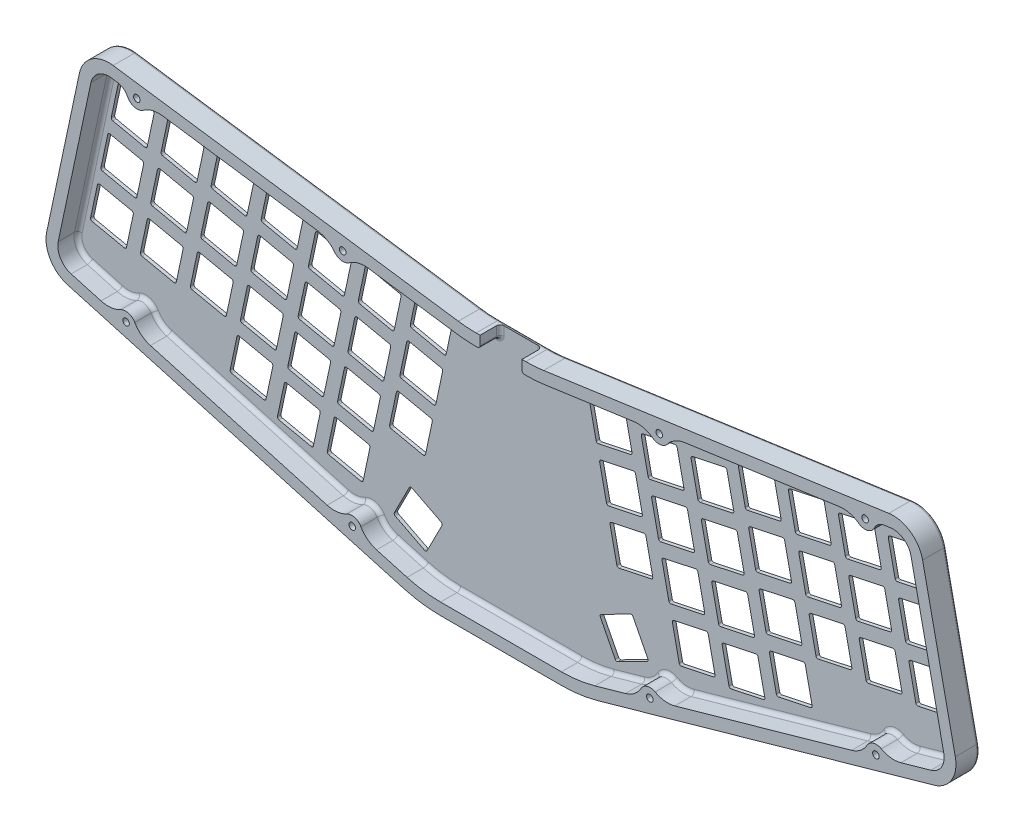
from build123d import *

# Parameters (mm, degrees)
MODEL_R             = 1.25
BOSS_EXTRUDE1_DEPTH = 9
BOSS_EXTRUDE2_DEPTH = 1.3
MODEL_4_R           = 1.25
BOSS_EXTRUDE3_DEPTH = 2
CUT_EXTRUDE1_DEPTH  = 10
FILLET2_R           = 1
FILLET3_R           = 1
FILLET4_R           = 1.5
FILLET6_R           = 1


with BuildPart() as part:
    # Model → Boss-Extrude1 (new body)
    with BuildSketch(Plane.XY):
        with BuildLine():
            ThreePointArc((176.403737975, 57.612801897), (173.012294783, 57.253677545), (169.603999044, 57.1337718))
            Line((169.603999044, 57.1337718), (150.648829756, 57.1337718))
            ThreePointArc((150.648829756, 57.1337718), (147.240534017, 57.253677545), (143.849090824, 57.612801897))
            Line((143.849090824, 57.612801897), (12.081352867, 76.271030157))
            ThreePointArc((12.081352867, 76.271030157), (3.877804033, 74.308284837), (-0.779653775, 67.275599046))
            Line((-0.779653775, 67.275599046), (-13.274730709, 8.490883588))
            ThreePointArc((-13.274730709, 8.490883588), (-11.871459071, 0.157038619), (-5.151125733, -4.967340667))
            Line((-5.151125733, -4.967340667), (123.055393281, -41.169431628))
            ThreePointArc((123.055393281, -41.169431628), (129.986107868, -42.620640598), (137.050372447, -43.1074446))
            Line((137.050372447, -43.1074446), (183.202456353, -43.1074446))
            ThreePointArc((183.202456353, -43.1074446), (190.266720932, -42.620640598), (197.197435519, -41.169431628))
            Line((197.197435519, -41.169431628), (325.403954533, -4.967340667))
            ThreePointArc((325.403954533, -4.967340667), (332.124287871, 0.157038619), (333.527559509, 8.490883588))
            Line((333.527559509, 8.490883588), (321.032482575, 67.275599045))
            ThreePointArc((321.032482575, 67.275599045), (316.375024767, 74.308284836), (308.171475933, 76.271030156))
            Line((308.171475933, 76.271030156), (176.403737975, 57.612801897))
        make_face()
        with Locations((103.335575354, -30.405568574)):
            Circle(MODEL_R, mode=Mode.SUBTRACT)
        with Locations((17.039281052, -6.037803815)):
            Circle(MODEL_R, mode=Mode.SUBTRACT)
        with Locations((216.917253446, -30.405568574)):
            Circle(MODEL_R, mode=Mode.SUBTRACT)
        with Locations((303.213547748, -6.037803815)):
            Circle(MODEL_R, mode=Mode.SUBTRACT)
        with Locations((21.146353911, 69.937554571)):
            Circle(MODEL_R, mode=Mode.SUBTRACT)
        with Locations((99.718342652, 58.811810716)):
            Circle(MODEL_R, mode=Mode.SUBTRACT)
        with BuildLine():
            Line((124.278255538, -36.838772567), (112.628950613, -33.549320519))
            ThreePointArc((112.628950613, -33.549320519), (109.193120681, -31.80832864), (106.670193349, -28.897861715))
            ThreePointArc((106.670193349, -28.897861715), (104.286690443, -27.037278193), (101.282051153, -27.376394512))
            ThreePointArc((101.282051153, -27.376394512), (97.609446415, -28.537408934), (93.770452927, -28.224185309))
            Line((93.770452927, -28.224185309), (26.332656311, -9.18155576))
            ThreePointArc((26.332656311, -9.18155576), (22.896826379, -7.440563881), (20.373899046, -4.530096956))
            ThreePointArc((20.373899046, -4.530096956), (17.99039614, -2.669513434), (14.98575685, -3.008629753))
            ThreePointArc((14.98575685, -3.008629753), (11.313152113, -4.169644175), (7.474158624, -3.85642055))
            Line((7.474158624, -3.85642055), (-3.928263476, -0.636681606))
            ThreePointArc((-3.928263476, -0.636681606), (-8.01890116, 2.482505785), (-8.873066505, 7.555280983))
            Line((-8.873066505, 7.555280983), (3.622010429, 66.339996442))
            ThreePointArc((3.622010429, 66.339996442), (6.456984747, 70.620761706), (11.450449255, 71.815476249))
            Line((11.450449255, 71.815476249), (13.807051559, 71.481782855))
            ThreePointArc((13.807051559, 71.481782855), (16.05801748, 70.566743382), (17.611829082, 68.698638909))
            ThreePointArc((17.611829082, 68.698638909), (20.250303311, 66.551050421), (23.587647853, 67.21121251))
            ThreePointArc((23.587647853, 67.21121251), (27.071325394, 68.854371308), (30.917639732, 69.058934404))
            Line((30.917639732, 69.058934404), (90.087257633, 60.680553975))
            ThreePointArc((90.087257633, 60.680553975), (93.725570339, 59.416172428), (96.616102068, 56.870429634))
            ThreePointArc((96.616102068, 56.870429634), (99.227639842, 55.346379898), (102.159636594, 56.085468655))
            ThreePointArc((102.159636594, 56.085468655), (105.643314135, 57.728627453), (109.489628473, 57.933190549))
            Line((109.489628473, 57.933190549), (143.218187212, 53.157247988))
            ThreePointArc((143.218187212, 53.157247988), (146.924300392, 52.76480282), (150.648829756, 52.6337718))
            Line((150.648829756, 52.6337718), (169.603999044, 52.6337718))
            ThreePointArc((169.603999044, 52.6337718), (173.328528408, 52.76480282), (177.034641588, 53.157247988))
            Line((177.034641588, 53.157247988), (210.763200327, 57.933190549))
            ThreePointArc((210.763200327, 57.933190549), (214.609514665, 57.728627453), (218.093192206, 56.085468655))
            ThreePointArc((218.093192206, 56.085468655), (221.025188958, 55.346379898), (223.636726732, 56.870429634))
            ThreePointArc((223.636726732, 56.870429634), (226.52725846, 59.416172428), (230.165571167, 60.680553974))
            Line((230.165571167, 60.680553974), (289.335189068, 69.058934403))
            ThreePointArc((289.335189068, 69.058934403), (293.181503406, 68.854371307), (296.665180948, 67.211212509))
            ThreePointArc((296.665180948, 67.211212509), (300.002525489, 66.55105042), (302.640999718, 68.698638908))
            ThreePointArc((302.640999718, 68.698638908), (304.19481132, 70.566743381), (306.445777241, 71.481782853))
            Line((306.445777241, 71.481782853), (308.802379545, 71.815476247))
            ThreePointArc((308.802379545, 71.815476247), (313.795844053, 70.620761705), (316.630818371, 66.339996441))
            Line((316.630818371, 66.339996441), (329.125895305, 7.555280983))
            ThreePointArc((329.125895305, 7.555280983), (328.27172996, 2.482505785), (324.181092276, -0.636681606))
            Line((324.181092276, -0.636681606), (312.778670176, -3.85642055))
            ThreePointArc((312.778670176, -3.85642055), (308.939676687, -4.169644175), (305.26707195, -3.008629753))
            ThreePointArc((305.26707195, -3.008629753), (302.26243266, -2.669513434), (299.878929754, -4.530096956))
            ThreePointArc((299.878929754, -4.530096956), (297.356002421, -7.440563881), (293.920172489, -9.18155576))
            Line((293.920172489, -9.18155576), (226.482375873, -28.224185309))
            ThreePointArc((226.482375873, -28.224185309), (222.643382385, -28.537408934), (218.970777647, -27.376394512))
            ThreePointArc((218.970777647, -27.376394512), (215.966138357, -27.037278193), (213.582635451, -28.897861715))
            ThreePointArc((213.582635451, -28.897861715), (211.059708119, -31.80832864), (207.623878187, -33.549320519))
            Line((207.623878187, -33.549320519), (195.974573262, -36.838772567))
            ThreePointArc((195.974573262, -36.838772567), (189.649455095, -38.16317687), (183.202456353, -38.6074446))
            Line((183.202456353, -38.6074446), (137.050372447, -38.6074446))
            ThreePointArc((137.050372447, -38.6074446), (130.603373705, -38.16317687), (124.278255538, -36.838772567))
        make_face(mode=Mode.SUBTRACT)
        with Locations((220.534486148, 58.811810716)):
            Circle(MODEL_R, mode=Mode.SUBTRACT)
        with Locations((299.10647489, 69.93755457)):
            Circle(MODEL_R, mode=Mode.SUBTRACT)
    extrude(amount=BOSS_EXTRUDE1_DEPTH)

    # Model<3> → Boss-Extrude2 (add)
    with BuildSketch(Plane.XY):
        with BuildLine():
            ThreePointArc((106.670193349, -28.897861715), (109.193120681, -31.80832864), (112.628950613, -33.549320519))
            Line((112.628950613, -33.549320519), (124.278255538, -36.838772567))
            ThreePointArc((124.278255538, -36.838772567), (130.603373705, -38.16317687), (137.050372447, -38.6074446))
            Line((137.050372447, -38.6074446), (160.1264144, -38.6074446))
            Line((160.1264144, -38.6074446), (183.202456353, -38.6074446))
            ThreePointArc((183.202456353, -38.6074446), (189.649455095, -38.16317687), (195.974573262, -36.838772567))
            Line((195.974573262, -36.838772567), (207.623878187, -33.549320519))
            ThreePointArc((207.623878187, -33.549320519), (211.059708119, -31.80832864), (213.582635451, -28.897861715))
            ThreePointArc((213.582635451, -28.897861715), (215.966138357, -27.037278193), (218.970777647, -27.376394512))
            ThreePointArc((218.970777647, -27.376394512), (222.643382385, -28.537408934), (226.482375873, -28.224185309))
            Line((226.482375873, -28.224185309), (271.948963849, -15.385637267))
            Line((271.948963849, -15.385637267), (293.920172489, -9.18155576))
            ThreePointArc((293.920172489, -9.18155576), (297.356002421, -7.440563881), (299.878929754, -4.530096956))
            ThreePointArc((299.878929754, -4.530096956), (302.26243266, -2.669513434), (305.26707195, -3.008629753))
            ThreePointArc((305.26707195, -3.008629753), (308.939676687, -4.169644175), (312.778670176, -3.85642055))
            Line((312.778670176, -3.85642055), (324.181092276, -0.636681606))
            ThreePointArc((324.181092276, -0.636681606), (328.27172996, 2.482505785), (329.125895305, 7.555280983))
            Line((329.125895305, 7.555280983), (322.378197452, 39.30070363))
            Line((322.378197452, 39.30070363), (316.630818371, 66.339996441))
            ThreePointArc((316.630818371, 66.339996441), (313.795844053, 70.620761705), (308.802379545, 71.815476247))
            Line((308.802379545, 71.815476247), (306.445777241, 71.481782853))
            ThreePointArc((306.445777241, 71.481782853), (304.19481132, 70.566743381), (302.640999718, 68.698638908))
            ThreePointArc((302.640999718, 68.698638908), (300.002525489, 66.55105042), (296.665180948, 67.211212509))
            ThreePointArc((296.665180948, 67.211212509), (293.181503406, 68.854371307), (289.335189068, 69.058934403))
            Line((289.335189068, 69.058934403), (230.165571167, 60.680553974))
            ThreePointArc((230.165571167, 60.680553974), (226.52725846, 59.416172428), (223.636726732, 56.870429634))
            ThreePointArc((223.636726732, 56.870429634), (221.025188958, 55.346379898), (218.093192206, 56.085468655))
            ThreePointArc((218.093192206, 56.085468655), (214.609514665, 57.728627453), (210.763200327, 57.933190549))
            Line((210.763200327, 57.933190549), (177.034641588, 53.157247988))
            ThreePointArc((177.034641588, 53.157247988), (173.328528408, 52.76480282), (169.603999044, 52.6337718))
            Line((169.603999044, 52.6337718), (150.648829756, 52.6337718))
            ThreePointArc((150.648829756, 52.6337718), (146.924300392, 52.76480282), (143.218187212, 53.157247988))
            Line((143.218187212, 53.157247988), (109.489628473, 57.933190549))
            ThreePointArc((109.489628473, 57.933190549), (105.643314135, 57.728627453), (102.159636594, 56.085468655))
            ThreePointArc((102.159636594, 56.085468655), (99.227639842, 55.346379898), (96.616102068, 56.870429634))
            ThreePointArc((96.616102068, 56.870429634), (93.725570339, 59.416172428), (90.087257633, 60.680553975))
            Line((90.087257633, 60.680553975), (30.917639732, 69.058934404))
            ThreePointArc((30.917639732, 69.058934404), (27.071325394, 68.854371308), (23.587647853, 67.21121251))
            ThreePointArc((23.587647853, 67.21121251), (20.250303311, 66.551050421), (17.611829082, 68.698638909))
            ThreePointArc((17.611829082, 68.698638909), (16.05801748, 70.566743382), (13.807051559, 71.481782855))
            Line((13.807051559, 71.481782855), (11.450449255, 71.815476249))
            ThreePointArc((11.450449255, 71.815476249), (6.456984747, 70.620761706), (3.622010429, 66.339996442))
            Line((3.622010429, 66.339996442), (-2.125368652, 39.30070363))
            Line((-2.125368652, 39.30070363), (-8.873066505, 7.555280983))
            ThreePointArc((-8.873066505, 7.555280983), (-8.01890116, 2.482505785), (-3.928263476, -0.636681606))
            Line((-3.928263476, -0.636681606), (7.474158624, -3.85642055))
            ThreePointArc((7.474158624, -3.85642055), (11.313152113, -4.169644175), (14.98575685, -3.008629753))
            ThreePointArc((14.98575685, -3.008629753), (17.99039614, -2.669513434), (20.373899046, -4.530096956))
            ThreePointArc((20.373899046, -4.530096956), (22.896826379, -7.440563881), (26.332656311, -9.18155576))
            Line((26.332656311, -9.18155576), (48.303864951, -15.385637267))
            Line((48.303864951, -15.385637267), (93.770452927, -28.224185309))
            ThreePointArc((93.770452927, -28.224185309), (97.609446415, -28.537408934), (101.282051153, -27.376394512))
            ThreePointArc((101.282051153, -27.376394512), (104.286690443, -27.037278193), (106.670193349, -28.897861715))
        make_face()
        with BuildLine():
            ThreePointArc((88.727862955, -5.824846865), (89.052994379, -5.351777707), (89.617407423, -5.247169932))
            Line((89.617407423, -5.247169932), (101.844252435, -7.846066055))
            ThreePointArc((101.844252435, -7.846066055), (102.317321593, -8.171197479), (102.421929368, -8.735610523))
            Line((102.421929368, -8.735610523), (99.823033245, -20.962455535))
            ThreePointArc((99.823033245, -20.962455535), (99.497901821, -21.435524693), (98.933488777, -21.540132468))
            Line((98.933488777, -21.540132468), (86.706643765, -18.941236345))
            ThreePointArc((86.706643765, -18.941236345), (86.233574607, -18.616104921), (86.128966832, -18.051691877))
            Line((86.128966832, -18.051691877), (88.727862955, -5.824846865))
        make_face(mode=Mode.SUBTRACT)
        with BuildLine():
            Line((123.222791405, -32.202255303), (117.65400063, -29.364814683))
            Line((117.65400063, -29.364814683), (112.08520985, -26.527374062))
            ThreePointArc((112.08520985, -26.527374062), (111.712410337, -26.090881916), (111.75744783, -25.518626297))
            Line((111.75744783, -25.518626297), (117.432329033, -14.381044722))
            ThreePointArc((117.432329033, -14.381044722), (117.86882118, -14.008245208), (118.441076802, -14.053282701))
            Line((118.441076802, -14.053282701), (129.578658358, -19.728163942))
            ThreePointArc((129.578658358, -19.728163942), (129.95145787, -20.164656088), (129.906420378, -20.736911707))
            Line((129.906420378, -20.736911707), (124.231539174, -31.874493282))
            ThreePointArc((124.231539174, -31.874493282), (123.795047027, -32.247292796), (123.222791405, -32.202255303))
        make_face(mode=Mode.SUBTRACT)
        with BuildLine():
            ThreePointArc((51.662209955, 2.564871135), (51.987341379, 3.037940293), (52.551754423, 3.142548068))
            Line((52.551754423, 3.142548068), (64.778599435, 0.543651945))
            ThreePointArc((64.778599435, 0.543651945), (65.251668593, 0.218520521), (65.356276368, -0.345892523))
            Line((65.356276368, -0.345892523), (62.757380245, -12.572737535))
            ThreePointArc((62.757380245, -12.572737535), (62.432248821, -13.045806693), (61.867835777, -13.150414468))
            Line((61.867835777, -13.150414468), (49.640990765, -10.551518345))
            ThreePointArc((49.640990765, -10.551518345), (49.167921607, -10.226386921), (49.063313832, -9.661973877))
            Line((49.063313832, -9.661973877), (51.662209955, 2.564871135))
        make_face(mode=Mode.SUBTRACT)
        with BuildLine():
            ThreePointArc((17.403364705, 24.159581835), (17.728496129, 24.632650993), (18.292909173, 24.737258768))
            Line((18.292909173, 24.737258768), (30.519754185, 22.138362645))
            ThreePointArc((30.519754185, 22.138362645), (30.992823343, 21.813231221), (31.097431118, 21.248818177))
            Line((31.097431118, 21.248818177), (28.498534995, 9.021973165))
            ThreePointArc((28.498534995, 9.021973165), (28.173403571, 8.548904007), (27.608990527, 8.444296232))
            Line((27.608990527, 8.444296232), (15.382145515, 11.043192355))
            ThreePointArc((15.382145515, 11.043192355), (14.909076357, 11.368323779), (14.804468582, 11.932736823))
            Line((14.804468582, 11.932736823), (17.403364705, 24.159581835))
        make_face(mode=Mode.SUBTRACT)
        with BuildLine():
            ThreePointArc((36.507948405, 22.654628735), (36.833079829, 23.127697893), (37.397492873, 23.232305668))
            Line((37.397492873, 23.232305668), (49.624337885, 20.633409545))
            ThreePointArc((49.624337885, 20.633409545), (50.097407043, 20.308278121), (50.202014818, 19.743865077))
            Line((50.202014818, 19.743865077), (47.603118695, 7.517020065))
            ThreePointArc((47.603118695, 7.517020065), (47.277987271, 7.043950907), (46.713574227, 6.939343132))
            Line((46.713574227, 6.939343132), (34.486729215, 9.538239255))
            ThreePointArc((34.486729215, 9.538239255), (34.013660057, 9.863370679), (33.909052282, 10.427783723))
            Line((33.909052282, 10.427783723), (36.507948405, 22.654628735))
        make_face(mode=Mode.SUBTRACT)
        with BuildLine():
            ThreePointArc((55.612532005, 21.149675635), (55.937663429, 21.622744793), (56.502076473, 21.727352568))
            Line((56.502076473, 21.727352568), (68.728921485, 19.128456445))
            ThreePointArc((68.728921485, 19.128456445), (69.201990643, 18.803325021), (69.306598418, 18.238911977))
            Line((69.306598418, 18.238911977), (66.707702295, 6.012066965))
            ThreePointArc((66.707702295, 6.012066965), (66.382570871, 5.538997807), (65.818157827, 5.434390032))
            Line((65.818157827, 5.434390032), (53.591312815, 8.033286155))
            ThreePointArc((53.591312815, 8.033286155), (53.118243657, 8.358417579), (53.013635882, 8.922830623))
            Line((53.013635882, 8.922830623), (55.612532005, 21.149675635))
        make_face(mode=Mode.SUBTRACT)
        with BuildLine():
            ThreePointArc((69.727235155, -3.830819965), (70.052366579, -3.357750807), (70.616779623, -3.253143032))
            Line((70.616779623, -3.253143032), (82.843624635, -5.852039155))
            ThreePointArc((82.843624635, -5.852039155), (83.316693793, -6.177170579), (83.421301568, -6.741583623))
            Line((83.421301568, -6.741583623), (80.822405445, -18.968428635))
            ThreePointArc((80.822405445, -18.968428635), (80.497274021, -19.441497793), (79.932860977, -19.546105568))
            Line((79.932860977, -19.546105568), (67.706015965, -16.947209445))
            ThreePointArc((67.706015965, -16.947209445), (67.232946807, -16.622078021), (67.128339032, -16.057664977))
            Line((67.128339032, -16.057664977), (69.727235155, -3.830819965))
        make_face(mode=Mode.SUBTRACT)
        with BuildLine():
            ThreePointArc((73.677557205, 14.753984435), (74.002688629, 15.227053593), (74.567101673, 15.331661368))
            Line((74.567101673, 15.331661368), (86.793946685, 12.732765245))
            ThreePointArc((86.793946685, 12.732765245), (87.267015843, 12.407633821), (87.371623618, 11.843220777))
            Line((87.371623618, 11.843220777), (84.772727495, -0.383624235))
            ThreePointArc((84.772727495, -0.383624235), (84.447596071, -0.856693393), (83.883183027, -0.961301168))
            Line((83.883183027, -0.961301168), (71.656338015, 1.637594955))
            ThreePointArc((71.656338015, 1.637594955), (71.183268857, 1.962726379), (71.078661082, 2.527139423))
            Line((71.078661082, 2.527139423), (73.677557205, 14.753984435))
        make_face(mode=Mode.SUBTRACT)
        with BuildLine():
            ThreePointArc((92.678185005, 12.759957535), (93.003316429, 13.233026693), (93.567729473, 13.337634468))
            Line((93.567729473, 13.337634468), (105.794574485, 10.738738345))
            ThreePointArc((105.794574485, 10.738738345), (106.267643643, 10.413606921), (106.372251418, 9.849193877))
            Line((106.372251418, 9.849193877), (103.773355295, -2.377651135))
            ThreePointArc((103.773355295, -2.377651135), (103.448223871, -2.850720293), (102.883810827, -2.955328068))
            Line((102.883810827, -2.955328068), (90.656965815, -0.356431945))
            ThreePointArc((90.656965815, -0.356431945), (90.183896657, -0.031300521), (90.079288882, 0.533112523))
            Line((90.079288882, 0.533112523), (92.678185005, 12.759957535))
        make_face(mode=Mode.SUBTRACT)
        with BuildLine():
            ThreePointArc((112.510459605, 14.678521035), (112.835591029, 15.151590193), (113.400004073, 15.256197968))
            Line((113.400004073, 15.256197968), (125.626849085, 12.657301845))
            ThreePointArc((125.626849085, 12.657301845), (126.099918243, 12.332170421), (126.204526018, 11.767757377))
            Line((126.204526018, 11.767757377), (123.605629895, -0.459087635))
            ThreePointArc((123.605629895, -0.459087635), (123.280498471, -0.932156793), (122.716085427, -1.036764568))
            Line((122.716085427, -1.036764568), (110.489240415, 1.562131555))
            ThreePointArc((110.489240415, 1.562131555), (110.016171257, 1.887262979), (109.911563482, 2.451676023))
            Line((109.911563482, 2.451676023), (112.510459605, 14.678521035))
        make_face(mode=Mode.SUBTRACT)
        with BuildLine():
            Line((208.16761895, -26.527374062), (202.59882817, -29.364814683))
            Line((202.59882817, -29.364814683), (197.030037395, -32.202255303))
            ThreePointArc((197.030037395, -32.202255303), (196.457781773, -32.247292796), (196.021289626, -31.874493282))
            Line((196.021289626, -31.874493282), (190.346408422, -20.736911707))
            ThreePointArc((190.346408422, -20.736911707), (190.30137093, -20.164656088), (190.674170442, -19.728163942))
            Line((190.674170442, -19.728163942), (201.811751998, -14.053282701))
            ThreePointArc((201.811751998, -14.053282701), (202.38400762, -14.008245208), (202.820499767, -14.381044722))
            Line((202.820499767, -14.381044722), (208.49538097, -25.518626297))
            ThreePointArc((208.49538097, -25.518626297), (208.540418463, -26.090881916), (208.16761895, -26.527374062))
        make_face(mode=Mode.SUBTRACT)
        with BuildLine():
            Line((218.408576365, -7.846066055), (230.635421377, -5.247169932))
            ThreePointArc((230.635421377, -5.247169932), (231.199834421, -5.351777707), (231.524965845, -5.824846865))
            Line((231.524965845, -5.824846865), (234.123861968, -18.051691877))
            ThreePointArc((234.123861968, -18.051691877), (234.019254193, -18.616104921), (233.546185035, -18.941236345))
            Line((233.546185035, -18.941236345), (221.319340023, -21.540132468))
            ThreePointArc((221.319340023, -21.540132468), (220.754926979, -21.435524693), (220.429795555, -20.962455535))
            Line((220.429795555, -20.962455535), (217.830899432, -8.735610523))
            ThreePointArc((217.830899432, -8.735610523), (217.935507207, -8.171197479), (218.408576365, -7.846066055))
        make_face(mode=Mode.SUBTRACT)
        with BuildLine():
            Line((237.409204165, -5.852039155), (249.636049177, -3.253143032))
            ThreePointArc((249.636049177, -3.253143032), (250.200462221, -3.357750807), (250.525593645, -3.830819965))
            Line((250.525593645, -3.830819965), (253.124489768, -16.057664977))
            ThreePointArc((253.124489768, -16.057664977), (253.019881993, -16.622078021), (252.546812835, -16.947209445))
            Line((252.546812835, -16.947209445), (240.319967823, -19.546105568))
            ThreePointArc((240.319967823, -19.546105568), (239.755554779, -19.441497793), (239.430423355, -18.968428635))
            Line((239.430423355, -18.968428635), (236.831527232, -6.741583623))
            ThreePointArc((236.831527232, -6.741583623), (236.936135007, -6.177170579), (237.409204165, -5.852039155))
        make_face(mode=Mode.SUBTRACT)
        with BuildLine():
            Line((194.625979715, 12.657301845), (206.852824727, 15.256197968))
            ThreePointArc((206.852824727, 15.256197968), (207.417237771, 15.151590193), (207.742369195, 14.678521035))
            Line((207.742369195, 14.678521035), (210.341265318, 2.451676023))
            ThreePointArc((210.341265318, 2.451676023), (210.236657543, 1.887262979), (209.763588385, 1.562131555))
            Line((209.763588385, 1.562131555), (197.536743373, -1.036764568))
            ThreePointArc((197.536743373, -1.036764568), (196.972330329, -0.932156793), (196.647198905, -0.459087635))
            Line((196.647198905, -0.459087635), (194.048302782, 11.767757377))
            ThreePointArc((194.048302782, 11.767757377), (194.152910557, 12.332170421), (194.625979715, 12.657301845))
        make_face(mode=Mode.SUBTRACT)
        with BuildLine():
            Line((214.458254315, 10.738738345), (226.685099327, 13.337634468))
            ThreePointArc((226.685099327, 13.337634468), (227.249512371, 13.233026693), (227.574643795, 12.759957535))
            Line((227.574643795, 12.759957535), (230.173539918, 0.533112523))
            ThreePointArc((230.173539918, 0.533112523), (230.068932143, -0.031300521), (229.595862985, -0.356431945))
            Line((229.595862985, -0.356431945), (217.369017973, -2.955328068))
            ThreePointArc((217.369017973, -2.955328068), (216.804604929, -2.850720293), (216.479473505, -2.377651135))
            Line((216.479473505, -2.377651135), (213.880577382, 9.849193877))
            ThreePointArc((213.880577382, 9.849193877), (213.985185157, 10.413606921), (214.458254315, 10.738738345))
        make_face(mode=Mode.SUBTRACT)
        with BuildLine():
            Line((233.458882115, 12.732765245), (245.685727127, 15.331661368))
            ThreePointArc((245.685727127, 15.331661368), (246.250140171, 15.227053593), (246.575271595, 14.753984435))
            Line((246.575271595, 14.753984435), (249.174167718, 2.527139423))
            ThreePointArc((249.174167718, 2.527139423), (249.069559943, 1.962726379), (248.596490785, 1.637594955))
            Line((248.596490785, 1.637594955), (236.369645773, -0.961301168))
            ThreePointArc((236.369645773, -0.961301168), (235.805232729, -0.856693393), (235.480101305, -0.383624235))
            Line((235.480101305, -0.383624235), (232.881205182, 11.843220777))
            ThreePointArc((232.881205182, 11.843220777), (232.985812957, 12.407633821), (233.458882115, 12.732765245))
        make_face(mode=Mode.SUBTRACT)
        with BuildLine():
            Line((255.474229365, 0.543651945), (267.701074377, 3.142548068))
            ThreePointArc((267.701074377, 3.142548068), (268.265487421, 3.037940293), (268.590618845, 2.564871135))
            Line((268.590618845, 2.564871135), (271.189514968, -9.661973877))
            ThreePointArc((271.189514968, -9.661973877), (271.084907193, -10.226386921), (270.611838035, -10.551518345))
            Line((270.611838035, -10.551518345), (258.384993023, -13.150414468))
            ThreePointArc((258.384993023, -13.150414468), (257.820579979, -13.045806693), (257.495448555, -12.572737535))
            Line((257.495448555, -12.572737535), (254.896552432, -0.345892523))
            ThreePointArc((254.896552432, -0.345892523), (255.001160207, 0.218520521), (255.474229365, 0.543651945))
        make_face(mode=Mode.SUBTRACT)
        with BuildLine():
            Line((251.523907315, 19.128456445), (263.750752327, 21.727352568))
            ThreePointArc((263.750752327, 21.727352568), (264.315165371, 21.622744793), (264.640296795, 21.149675635))
            Line((264.640296795, 21.149675635), (267.239192918, 8.922830623))
            ThreePointArc((267.239192918, 8.922830623), (267.134585143, 8.358417579), (266.661515985, 8.033286155))
            Line((266.661515985, 8.033286155), (254.434670973, 5.434390032))
            ThreePointArc((254.434670973, 5.434390032), (253.870257929, 5.538997807), (253.545126505, 6.012066965))
            Line((253.545126505, 6.012066965), (250.946230382, 18.238911977))
            ThreePointArc((250.946230382, 18.238911977), (251.050838157, 18.803325021), (251.523907315, 19.128456445))
        make_face(mode=Mode.SUBTRACT)
        with BuildLine():
            Line((270.628490915, 20.633409545), (282.855335927, 23.232305668))
            ThreePointArc((282.855335927, 23.232305668), (283.419748971, 23.127697893), (283.744880395, 22.654628735))
            Line((283.744880395, 22.654628735), (286.343776518, 10.427783723))
            ThreePointArc((286.343776518, 10.427783723), (286.239168743, 9.863370679), (285.766099585, 9.538239255))
            Line((285.766099585, 9.538239255), (273.539254573, 6.939343132))
            ThreePointArc((273.539254573, 6.939343132), (272.974841529, 7.043950907), (272.649710105, 7.517020065))
            Line((272.649710105, 7.517020065), (270.050813982, 19.743865077))
            ThreePointArc((270.050813982, 19.743865077), (270.155421757, 20.308278121), (270.628490915, 20.633409545))
        make_face(mode=Mode.SUBTRACT)
        with BuildLine():
            Line((289.733074615, 22.138362645), (301.959919627, 24.737258768))
            ThreePointArc((301.959919627, 24.737258768), (302.524332671, 24.632650993), (302.849464095, 24.159581835))
            Line((302.849464095, 24.159581835), (305.448360218, 11.932736823))
            ThreePointArc((305.448360218, 11.932736823), (305.343752443, 11.368323779), (304.870683285, 11.043192355))
            Line((304.870683285, 11.043192355), (292.643838273, 8.444296232))
            ThreePointArc((292.643838273, 8.444296232), (292.079425229, 8.548904007), (291.754293805, 9.021973165))
            Line((291.754293805, 9.021973165), (289.155397682, 21.248818177))
            ThreePointArc((289.155397682, 21.248818177), (289.260005457, 21.813231221), (289.733074615, 22.138362645))
        make_face(mode=Mode.SUBTRACT)
        with BuildLine():
            ThreePointArc((-1.597263045, 26.153608735), (-1.272131621, 26.626677893), (-0.707718577, 26.731285668))
            Line((-0.707718577, 26.731285668), (11.519126435, 24.132389545))
            ThreePointArc((11.519126435, 24.132389545), (11.992195593, 23.807258121), (12.096803368, 23.242845077))
            Line((12.096803368, 23.242845077), (9.497907245, 11.016000065))
            ThreePointArc((9.497907245, 11.016000065), (9.172775821, 10.542930907), (8.608362777, 10.438323132))
            Line((8.608362777, 10.438323132), (-3.618482235, 13.037219255))
            ThreePointArc((-3.618482235, 13.037219255), (-4.091551393, 13.362350679), (-4.196159168, 13.926763723))
            Line((-4.196159168, 13.926763723), (-1.597263045, 26.153608735))
        make_face(mode=Mode.SUBTRACT)
        with BuildLine():
            ThreePointArc((2.353059155, 44.738413135), (2.678190579, 45.211482293), (3.242603623, 45.316090068))
            Line((3.242603623, 45.316090068), (15.469448635, 42.717193945))
            ThreePointArc((15.469448635, 42.717193945), (15.942517793, 42.392062521), (16.047125568, 41.827649477))
            Line((16.047125568, 41.827649477), (13.448229445, 29.600804465))
            ThreePointArc((13.448229445, 29.600804465), (13.123098021, 29.127735307), (12.558684977, 29.023127532))
            Line((12.558684977, 29.023127532), (0.331839965, 31.622023655))
            ThreePointArc((0.331839965, 31.622023655), (-0.141229193, 31.947155079), (-0.245836968, 32.511568123))
            Line((-0.245836968, 32.511568123), (2.353059155, 44.738413135))
        make_face(mode=Mode.SUBTRACT)
        with BuildLine():
            ThreePointArc((21.353686905, 42.744386235), (21.678818329, 43.217455393), (22.243231373, 43.322063168))
            Line((22.243231373, 43.322063168), (34.470076385, 40.723167045))
            ThreePointArc((34.470076385, 40.723167045), (34.943145543, 40.398035621), (35.047753318, 39.833622577))
            Line((35.047753318, 39.833622577), (32.448857195, 27.606777565))
            ThreePointArc((32.448857195, 27.606777565), (32.123725771, 27.133708407), (31.559312727, 27.029100632))
            Line((31.559312727, 27.029100632), (19.332467715, 29.627996755))
            ThreePointArc((19.332467715, 29.627996755), (18.859398557, 29.953128179), (18.754790782, 30.517541223))
            Line((18.754790782, 30.517541223), (21.353686905, 42.744386235))
        make_face(mode=Mode.SUBTRACT)
        with BuildLine():
            ThreePointArc((40.458270605, 41.239433135), (40.783402029, 41.712502293), (41.347815073, 41.817110068))
            Line((41.347815073, 41.817110068), (53.574660085, 39.218213945))
            ThreePointArc((53.574660085, 39.218213945), (54.047729243, 38.893082521), (54.152337018, 38.328669477))
            Line((54.152337018, 38.328669477), (51.553440895, 26.101824465))
            ThreePointArc((51.553440895, 26.101824465), (51.228309471, 25.628755307), (50.663896427, 25.524147532))
            Line((50.663896427, 25.524147532), (38.437051415, 28.123043655))
            ThreePointArc((38.437051415, 28.123043655), (37.963982257, 28.448175079), (37.859374482, 29.012588123))
            Line((37.859374482, 29.012588123), (40.458270605, 41.239433135))
        make_face(mode=Mode.SUBTRACT)
        with BuildLine():
            ThreePointArc((59.562854205, 39.734480035), (59.887985629, 40.207549193), (60.452398673, 40.312156968))
            Line((60.452398673, 40.312156968), (72.679243685, 37.713260845))
            ThreePointArc((72.679243685, 37.713260845), (73.152312843, 37.388129421), (73.256920618, 36.823716377))
            Line((73.256920618, 36.823716377), (70.658024495, 24.596871365))
            ThreePointArc((70.658024495, 24.596871365), (70.332893071, 24.123802207), (69.768480027, 24.019194432))
            Line((69.768480027, 24.019194432), (57.541635015, 26.618090555))
            ThreePointArc((57.541635015, 26.618090555), (57.068565857, 26.943221979), (56.963958082, 27.507635023))
            Line((56.963958082, 27.507635023), (59.562854205, 39.734480035))
        make_face(mode=Mode.SUBTRACT)
        with BuildLine():
            ThreePointArc((96.628507205, 31.344761935), (96.953638629, 31.817831093), (97.518051673, 31.922438868))
            Line((97.518051673, 31.922438868), (109.744896685, 29.323542745))
            ThreePointArc((109.744896685, 29.323542745), (110.217965843, 28.998411321), (110.322573618, 28.433998277))
            Line((110.322573618, 28.433998277), (107.723677495, 16.207153265))
            ThreePointArc((107.723677495, 16.207153265), (107.398546071, 15.734084107), (106.834133027, 15.629476332))
            Line((106.834133027, 15.629476332), (94.607288015, 18.228372455))
            ThreePointArc((94.607288015, 18.228372455), (94.134218857, 18.553503879), (94.029611082, 19.117916923))
            Line((94.029611082, 19.117916923), (96.628507205, 31.344761935))
        make_face(mode=Mode.SUBTRACT)
        with BuildLine():
            ThreePointArc((77.627879405, 33.338788835), (77.953010829, 33.811857993), (78.517423873, 33.916465768))
            Line((78.517423873, 33.916465768), (90.744268885, 31.317569645))
            ThreePointArc((90.744268885, 31.317569645), (91.217338043, 30.992438221), (91.321945818, 30.428025177))
            Line((91.321945818, 30.428025177), (88.723049695, 18.201180165))
            ThreePointArc((88.723049695, 18.201180165), (88.397918271, 17.728111007), (87.833505227, 17.623503232))
            Line((87.833505227, 17.623503232), (75.606660215, 20.222399355))
            ThreePointArc((75.606660215, 20.222399355), (75.133591057, 20.547530779), (75.028983282, 21.111943823))
            Line((75.028983282, 21.111943823), (77.627879405, 33.338788835))
        make_face(mode=Mode.SUBTRACT)
        with BuildLine():
            ThreePointArc((116.460781805, 33.263325435), (116.785913229, 33.736394593), (117.350326273, 33.841002368))
            Line((117.350326273, 33.841002368), (129.577171285, 31.242106245))
            ThreePointArc((129.577171285, 31.242106245), (130.050240443, 30.916974821), (130.154848218, 30.352561777))
            Line((130.154848218, 30.352561777), (127.555952095, 18.125716765))
            ThreePointArc((127.555952095, 18.125716765), (127.230820671, 17.652647607), (126.666407627, 17.548039832))
            Line((126.666407627, 17.548039832), (114.439562615, 20.146935955))
            ThreePointArc((114.439562615, 20.146935955), (113.966493457, 20.472067379), (113.861885682, 21.036480423))
            Line((113.861885682, 21.036480423), (116.460781805, 33.263325435))
        make_face(mode=Mode.SUBTRACT)
        with BuildLine():
            ThreePointArc((81.578201505, 51.923593235), (81.903332929, 52.396662393), (82.467745973, 52.501270168))
            Line((82.467745973, 52.501270168), (94.694590985, 49.902374045))
            ThreePointArc((94.694590985, 49.902374045), (95.167660143, 49.577242621), (95.272267918, 49.012829577))
            Line((95.272267918, 49.012829577), (92.673371795, 36.785984565))
            ThreePointArc((92.673371795, 36.785984565), (92.348240371, 36.312915407), (91.783827327, 36.208307632))
            Line((91.783827327, 36.208307632), (79.556982315, 38.807203755))
            ThreePointArc((79.556982315, 38.807203755), (79.083913157, 39.132335179), (78.979305382, 39.696748223))
            Line((78.979305382, 39.696748223), (81.578201505, 51.923593235))
        make_face(mode=Mode.SUBTRACT)
        with BuildLine():
            ThreePointArc((100.578829305, 49.929566335), (100.903960729, 50.402635493), (101.468373773, 50.507243268))
            Line((101.468373773, 50.507243268), (113.695218785, 47.908347145))
            ThreePointArc((113.695218785, 47.908347145), (114.168287943, 47.583215721), (114.272895718, 47.018802677))
            Line((114.272895718, 47.018802677), (111.673999595, 34.791957665))
            ThreePointArc((111.673999595, 34.791957665), (111.348868171, 34.318888507), (110.784455127, 34.214280732))
            Line((110.784455127, 34.214280732), (98.557610115, 36.813176855))
            ThreePointArc((98.557610115, 36.813176855), (98.084540957, 37.138308279), (97.979933182, 37.702721323))
            Line((97.979933182, 37.702721323), (100.578829305, 49.929566335))
        make_face(mode=Mode.SUBTRACT)
        with BuildLine():
            ThreePointArc((133.527493385, 49.826910645), (134.000562543, 49.501779221), (134.105170318, 48.937366177))
            Line((134.105170318, 48.937366177), (131.506274195, 36.710521165))
            ThreePointArc((131.506274195, 36.710521165), (131.181142771, 36.237452007), (130.616729727, 36.132844232))
            Line((130.616729727, 36.132844232), (118.389884715, 38.731740355))
            ThreePointArc((118.389884715, 38.731740355), (117.916815557, 39.056871779), (117.812207782, 39.621284823))
            Line((117.812207782, 39.621284823), (120.411103905, 51.848129835))
            ThreePointArc((120.411103905, 51.848129835), (120.736235329, 52.321198993), (121.300648373, 52.425806768))
            Line((121.300648373, 52.425806768), (133.527493385, 49.826910645))
        make_face(mode=Mode.SUBTRACT)
        with BuildLine():
            ThreePointArc((6.303381255, 63.323217535), (6.628512679, 63.796286693), (7.192925723, 63.900894468))
            Line((7.192925723, 63.900894468), (19.419770735, 61.301998345))
            ThreePointArc((19.419770735, 61.301998345), (19.892839893, 60.976866921), (19.997447668, 60.412453877))
            Line((19.997447668, 60.412453877), (17.398551545, 48.185608865))
            ThreePointArc((17.398551545, 48.185608865), (17.073420121, 47.712539707), (16.509007077, 47.607931932))
            Line((16.509007077, 47.607931932), (4.282162065, 50.206828055))
            ThreePointArc((4.282162065, 50.206828055), (3.809092907, 50.531959479), (3.704485132, 51.096372523))
            Line((3.704485132, 51.096372523), (6.303381255, 63.323217535))
        make_face(mode=Mode.SUBTRACT)
        with BuildLine():
            ThreePointArc((25.304009005, 61.329190635), (25.629140429, 61.802259793), (26.193553473, 61.906867568))
            Line((26.193553473, 61.906867568), (38.420398485, 59.307971445))
            ThreePointArc((38.420398485, 59.307971445), (38.893467643, 58.982840021), (38.998075418, 58.418426977))
            Line((38.998075418, 58.418426977), (36.399179295, 46.191581965))
            ThreePointArc((36.399179295, 46.191581965), (36.074047871, 45.718512807), (35.509634827, 45.613905032))
            Line((35.509634827, 45.613905032), (23.282789815, 48.212801155))
            ThreePointArc((23.282789815, 48.212801155), (22.809720657, 48.537932579), (22.705112882, 49.102345623))
            Line((22.705112882, 49.102345623), (25.304009005, 61.329190635))
        make_face(mode=Mode.SUBTRACT)
        with BuildLine():
            ThreePointArc((44.408592705, 59.824237535), (44.733724129, 60.297306693), (45.298137173, 60.401914468))
            Line((45.298137173, 60.401914468), (57.524982185, 57.803018345))
            ThreePointArc((57.524982185, 57.803018345), (57.998051343, 57.477886921), (58.102659118, 56.913473877))
            Line((58.102659118, 56.913473877), (55.503762995, 44.686628865))
            ThreePointArc((55.503762995, 44.686628865), (55.178631571, 44.213559707), (54.614218527, 44.108951932))
            Line((54.614218527, 44.108951932), (42.387373515, 46.707848055))
            ThreePointArc((42.387373515, 46.707848055), (41.914304357, 47.032979479), (41.809696582, 47.597392523))
            Line((41.809696582, 47.597392523), (44.408592705, 59.824237535))
        make_face(mode=Mode.SUBTRACT)
        with BuildLine():
            ThreePointArc((63.513176305, 58.319284435), (63.838307729, 58.792353593), (64.402720773, 58.896961368))
            Line((64.402720773, 58.896961368), (76.629565785, 56.298065245))
            ThreePointArc((76.629565785, 56.298065245), (77.102634943, 55.972933821), (77.207242718, 55.408520777))
            Line((77.207242718, 55.408520777), (74.608346595, 43.181675765))
            ThreePointArc((74.608346595, 43.181675765), (74.283215171, 42.708606607), (73.718802127, 42.603998832))
            Line((73.718802127, 42.603998832), (61.491957115, 45.202894955))
            ThreePointArc((61.491957115, 45.202894955), (61.018887957, 45.528026379), (60.914280182, 46.092439423))
            Line((60.914280182, 46.092439423), (63.513176305, 58.319284435))
        make_face(mode=Mode.SUBTRACT)
        with BuildLine():
            Line((190.675657515, 31.242106245), (202.902502527, 33.841002368))
            ThreePointArc((202.902502527, 33.841002368), (203.466915571, 33.736394593), (203.792046995, 33.263325435))
            Line((203.792046995, 33.263325435), (206.390943118, 21.036480423))
            ThreePointArc((206.390943118, 21.036480423), (206.286335343, 20.472067379), (205.813266185, 20.146935955))
            Line((205.813266185, 20.146935955), (193.586421173, 17.548039832))
            ThreePointArc((193.586421173, 17.548039832), (193.022008129, 17.652647607), (192.696876705, 18.125716765))
            Line((192.696876705, 18.125716765), (190.097980582, 30.352561777))
            ThreePointArc((190.097980582, 30.352561777), (190.202588357, 30.916974821), (190.675657515, 31.242106245))
        make_face(mode=Mode.SUBTRACT)
        with BuildLine():
            Line((210.507932115, 29.323542745), (222.734777127, 31.922438868))
            ThreePointArc((222.734777127, 31.922438868), (223.299190171, 31.817831093), (223.624321595, 31.344761935))
            Line((223.624321595, 31.344761935), (226.223217718, 19.117916923))
            ThreePointArc((226.223217718, 19.117916923), (226.118609943, 18.553503879), (225.645540785, 18.228372455))
            Line((225.645540785, 18.228372455), (213.418695773, 15.629476332))
            ThreePointArc((213.418695773, 15.629476332), (212.854282729, 15.734084107), (212.529151305, 16.207153265))
            Line((212.529151305, 16.207153265), (209.930255182, 28.433998277))
            ThreePointArc((209.930255182, 28.433998277), (210.034862957, 28.998411321), (210.507932115, 29.323542745))
        make_face(mode=Mode.SUBTRACT)
        with BuildLine():
            Line((229.508559915, 31.317569645), (241.735404927, 33.916465768))
            ThreePointArc((241.735404927, 33.916465768), (242.299817971, 33.811857993), (242.624949395, 33.338788835))
            Line((242.624949395, 33.338788835), (245.223845518, 21.111943823))
            ThreePointArc((245.223845518, 21.111943823), (245.119237743, 20.547530779), (244.646168585, 20.222399355))
            Line((244.646168585, 20.222399355), (232.419323573, 17.623503232))
            ThreePointArc((232.419323573, 17.623503232), (231.854910529, 17.728111007), (231.529779105, 18.201180165))
            Line((231.529779105, 18.201180165), (228.930882982, 30.428025177))
            ThreePointArc((228.930882982, 30.428025177), (229.035490757, 30.992438221), (229.508559915, 31.317569645))
        make_face(mode=Mode.SUBTRACT)
        with BuildLine():
            Line((188.746554605, 36.710521165), (186.147658482, 48.937366177))
            ThreePointArc((186.147658482, 48.937366177), (186.252266257, 49.501779221), (186.725335415, 49.826910645))
            Line((186.725335415, 49.826910645), (198.952180427, 52.425806768))
            ThreePointArc((198.952180427, 52.425806768), (199.516593471, 52.321198993), (199.841724895, 51.848129835))
            Line((199.841724895, 51.848129835), (202.440621018, 39.621284823))
            ThreePointArc((202.440621018, 39.621284823), (202.336013243, 39.056871779), (201.862944085, 38.731740355))
            Line((201.862944085, 38.731740355), (189.636099073, 36.132844232))
            ThreePointArc((189.636099073, 36.132844232), (189.071686029, 36.237452007), (188.746554605, 36.710521165))
        make_face(mode=Mode.SUBTRACT)
        with BuildLine():
            Line((206.557610015, 47.908347145), (218.784455027, 50.507243268))
            ThreePointArc((218.784455027, 50.507243268), (219.348868071, 50.402635493), (219.673999495, 49.929566335))
            Line((219.673999495, 49.929566335), (222.272895618, 37.702721323))
            ThreePointArc((222.272895618, 37.702721323), (222.168287843, 37.138308279), (221.695218685, 36.813176855))
            Line((221.695218685, 36.813176855), (209.468373673, 34.214280732))
            ThreePointArc((209.468373673, 34.214280732), (208.903960629, 34.318888507), (208.578829205, 34.791957665))
            Line((208.578829205, 34.791957665), (205.979933082, 47.018802677))
            ThreePointArc((205.979933082, 47.018802677), (206.084540857, 47.583215721), (206.557610015, 47.908347145))
        make_face(mode=Mode.SUBTRACT)
        with BuildLine():
            Line((225.558237815, 49.902374045), (237.785082827, 52.501270168))
            ThreePointArc((237.785082827, 52.501270168), (238.349495871, 52.396662393), (238.674627295, 51.923593235))
            Line((238.674627295, 51.923593235), (241.273523418, 39.696748223))
            ThreePointArc((241.273523418, 39.696748223), (241.168915643, 39.132335179), (240.695846485, 38.807203755))
            Line((240.695846485, 38.807203755), (228.469001473, 36.208307632))
            ThreePointArc((228.469001473, 36.208307632), (227.904588429, 36.312915407), (227.579457005, 36.785984565))
            Line((227.579457005, 36.785984565), (224.980560882, 49.012829577))
            ThreePointArc((224.980560882, 49.012829577), (225.085168657, 49.577242621), (225.558237815, 49.902374045))
        make_face(mode=Mode.SUBTRACT)
        with BuildLine():
            Line((308.733702365, 24.132389545), (320.960547377, 26.731285668))
            ThreePointArc((320.960547377, 26.731285668), (321.524960421, 26.626677893), (321.850091845, 26.153608735))
            Line((321.850091845, 26.153608735), (324.448987968, 13.926763723))
            ThreePointArc((324.448987968, 13.926763723), (324.344380193, 13.362350679), (323.871311035, 13.037219255))
            Line((323.871311035, 13.037219255), (311.644466023, 10.438323132))
            ThreePointArc((311.644466023, 10.438323132), (311.080052979, 10.542930907), (310.754921555, 11.016000065))
            Line((310.754921555, 11.016000065), (308.156025432, 23.242845077))
            ThreePointArc((308.156025432, 23.242845077), (308.260633207, 23.807258121), (308.733702365, 24.132389545))
        make_face(mode=Mode.SUBTRACT)
        with BuildLine():
            Line((247.573585115, 37.713260845), (259.800430127, 40.312156968))
            ThreePointArc((259.800430127, 40.312156968), (260.364843171, 40.207549193), (260.689974595, 39.734480035))
            Line((260.689974595, 39.734480035), (263.288870718, 27.507635023))
            ThreePointArc((263.288870718, 27.507635023), (263.184262943, 26.943221979), (262.711193785, 26.618090555))
            Line((262.711193785, 26.618090555), (250.484348773, 24.019194432))
            ThreePointArc((250.484348773, 24.019194432), (249.919935729, 24.123802207), (249.594804305, 24.596871365))
            Line((249.594804305, 24.596871365), (246.995908182, 36.823716377))
            ThreePointArc((246.995908182, 36.823716377), (247.100515957, 37.388129421), (247.573585115, 37.713260845))
        make_face(mode=Mode.SUBTRACT)
        with BuildLine():
            Line((266.678168715, 39.218213945), (278.905013727, 41.817110068))
            ThreePointArc((278.905013727, 41.817110068), (279.469426771, 41.712502293), (279.794558195, 41.239433135))
            Line((279.794558195, 41.239433135), (282.393454318, 29.012588123))
            ThreePointArc((282.393454318, 29.012588123), (282.288846543, 28.448175079), (281.815777385, 28.123043655))
            Line((281.815777385, 28.123043655), (269.588932373, 25.524147532))
            ThreePointArc((269.588932373, 25.524147532), (269.024519329, 25.628755307), (268.699387905, 26.101824465))
            Line((268.699387905, 26.101824465), (266.100491782, 38.328669477))
            ThreePointArc((266.100491782, 38.328669477), (266.205099557, 38.893082521), (266.678168715, 39.218213945))
        make_face(mode=Mode.SUBTRACT)
        with BuildLine():
            Line((285.782752415, 40.723167045), (298.009597427, 43.322063168))
            ThreePointArc((298.009597427, 43.322063168), (298.574010471, 43.217455393), (298.899141895, 42.744386235))
            Line((298.899141895, 42.744386235), (301.498038018, 30.517541223))
            ThreePointArc((301.498038018, 30.517541223), (301.393430243, 29.953128179), (300.920361085, 29.627996755))
            Line((300.920361085, 29.627996755), (288.693516073, 27.029100632))
            ThreePointArc((288.693516073, 27.029100632), (288.129103029, 27.133708407), (287.803971605, 27.606777565))
            Line((287.803971605, 27.606777565), (285.205075482, 39.833622577))
            ThreePointArc((285.205075482, 39.833622577), (285.309683257, 40.398035621), (285.782752415, 40.723167045))
        make_face(mode=Mode.SUBTRACT)
        with BuildLine():
            Line((304.783380165, 42.717193945), (317.010225177, 45.316090068))
            ThreePointArc((317.010225177, 45.316090068), (317.574638221, 45.211482293), (317.899769645, 44.738413135))
            Line((317.899769645, 44.738413135), (320.498665768, 32.511568123))
            ThreePointArc((320.498665768, 32.511568123), (320.394057993, 31.947155079), (319.920988835, 31.622023655))
            Line((319.920988835, 31.622023655), (307.694143823, 29.023127532))
            ThreePointArc((307.694143823, 29.023127532), (307.129730779, 29.127735307), (306.804599355, 29.600804465))
            Line((306.804599355, 29.600804465), (304.205703232, 41.827649477))
            ThreePointArc((304.205703232, 41.827649477), (304.310311007, 42.392062521), (304.783380165, 42.717193945))
        make_face(mode=Mode.SUBTRACT)
        with BuildLine():
            Line((243.623263015, 56.298065245), (255.850108027, 58.896961368))
            ThreePointArc((255.850108027, 58.896961368), (256.414521071, 58.792353593), (256.739652495, 58.319284435))
            Line((256.739652495, 58.319284435), (259.338548618, 46.092439423))
            ThreePointArc((259.338548618, 46.092439423), (259.233940843, 45.528026379), (258.760871685, 45.202894955))
            Line((258.760871685, 45.202894955), (246.534026673, 42.603998832))
            ThreePointArc((246.534026673, 42.603998832), (245.969613629, 42.708606607), (245.644482205, 43.181675765))
            Line((245.644482205, 43.181675765), (243.045586082, 55.408520777))
            ThreePointArc((243.045586082, 55.408520777), (243.150193857, 55.972933821), (243.623263015, 56.298065245))
        make_face(mode=Mode.SUBTRACT)
        with BuildLine():
            Line((262.727846615, 57.803018345), (274.954691627, 60.401914468))
            ThreePointArc((274.954691627, 60.401914468), (275.519104671, 60.297306693), (275.844236095, 59.824237535))
            Line((275.844236095, 59.824237535), (278.443132218, 47.597392523))
            ThreePointArc((278.443132218, 47.597392523), (278.338524443, 47.032979479), (277.865455285, 46.707848055))
            Line((277.865455285, 46.707848055), (265.638610273, 44.108951932))
            ThreePointArc((265.638610273, 44.108951932), (265.074197229, 44.213559707), (264.749065805, 44.686628865))
            Line((264.749065805, 44.686628865), (262.150169682, 56.913473877))
            ThreePointArc((262.150169682, 56.913473877), (262.254777457, 57.477886921), (262.727846615, 57.803018345))
        make_face(mode=Mode.SUBTRACT)
        with BuildLine():
            Line((281.832430315, 59.307971445), (294.059275327, 61.906867568))
            ThreePointArc((294.059275327, 61.906867568), (294.623688371, 61.802259793), (294.948819795, 61.329190635))
            Line((294.948819795, 61.329190635), (297.547715918, 49.102345623))
            ThreePointArc((297.547715918, 49.102345623), (297.443108143, 48.537932579), (296.970038985, 48.212801155))
            Line((296.970038985, 48.212801155), (284.743193973, 45.613905032))
            ThreePointArc((284.743193973, 45.613905032), (284.178780929, 45.718512807), (283.853649505, 46.191581965))
            Line((283.853649505, 46.191581965), (281.254753382, 58.418426977))
            ThreePointArc((281.254753382, 58.418426977), (281.359361157, 58.982840021), (281.832430315, 59.307971445))
        make_face(mode=Mode.SUBTRACT)
        with BuildLine():
            Line((300.833058065, 61.301998345), (313.059903077, 63.900894468))
            ThreePointArc((313.059903077, 63.900894468), (313.624316121, 63.796286693), (313.949447545, 63.323217535))
            Line((313.949447545, 63.323217535), (316.548343668, 51.096372523))
            ThreePointArc((316.548343668, 51.096372523), (316.443735893, 50.531959479), (315.970666735, 50.206828055))
            Line((315.970666735, 50.206828055), (303.743821723, 47.607931932))
            ThreePointArc((303.743821723, 47.607931932), (303.179408679, 47.712539707), (302.854277255, 48.185608865))
            Line((302.854277255, 48.185608865), (300.255381132, 60.412453877))
            ThreePointArc((300.255381132, 60.412453877), (300.359988907, 60.976866921), (300.833058065, 61.301998345))
        make_face(mode=Mode.SUBTRACT)
    extrude(amount=BOSS_EXTRUDE2_DEPTH)

    # Model<4> → Boss-Extrude3 (add)
    with BuildSketch(Plane.XY):
        with Locations((103.335575354, -30.405568574)):
            Circle(MODEL_4_R)
        with Locations((216.917253446, -30.405568574)):
            Circle(MODEL_4_R)
        with Locations((99.718342652, 58.811810716)):
            Circle(MODEL_4_R)
        with Locations((220.534486148, 58.811810716)):
            Circle(MODEL_4_R)
        with Locations((17.039281052, -6.037803815)):
            Circle(MODEL_4_R)
        with Locations((303.213547748, -6.037803815)):
            Circle(MODEL_4_R)
        with Locations((299.10647489, 69.93755457)):
            Circle(MODEL_4_R)
        with Locations((21.146353911, 69.937554571)):
            Circle(MODEL_4_R)
    extrude(amount=BOSS_EXTRUDE3_DEPTH)

    # Sketch3 → Cut-Extrude1 (cut)
    with BuildSketch(Plane(origin=(0, 57.1337718, 0), x_dir=(1, 0, 0), z_dir=(0, 1, 0))):
        Polygon((160.1264144, -1.3), (168.1264144, -1.3), (168.1264144, -9), (160.1264144, -9), (152.1264144, -9), (152.1264144, -1.3), align=None)
    extrude(amount=-CUT_EXTRUDE1_DEPTH, mode=Mode.SUBTRACT)

    # Fillet2
    fillet2_edges = [part.edges().sort_by_distance(p)[0] for p in [
        (152.1264144, 52.6337718, 5.15),
    ]]
    fillet(fillet2_edges, radius=FILLET2_R)

    # Fillet3
    fillet3_edges = [part.edges().sort_by_distance(p)[0] for p in [
        (168.1264144, 52.6337718, 5.15),
    ]]
    fillet(fillet3_edges, radius=FILLET3_R)

    # Fillet4
    fillet4_edges = [part.edges().sort_by_distance(p)[0] for p in [
        (146.924300392, 52.76480282, 1.3),
    ]]
    fillet(fillet4_edges, radius=FILLET4_R)

    # Fillet6
    fillet6_edges = [part.edges().sort_by_distance(p)[0] for p in [
        (147.240534017, 57.253677545, 0),
        (160.1264144, 57.1337718, 0),
        (173.012294783, 57.253677545, 0),
        (242.287606954, 66.941916026, 0),
        (316.375024767, 74.308284836, 0),
        (327.280021042, 37.883241316, 0),
        (332.124287871, 0.157038619, 0),
        (261.300695026, -23.068386147, 0),
        (190.266720932, -42.620640598, 0),
        (160.1264144, -43.1074446, 0),
        (129.986107868, -42.620640598, 0),
        (58.952133774, -23.068386147, 0),
        (-11.871459071, 0.157038619, 0),
        (-7.027192242, 37.883241317, 0),
        (3.877804033, 74.308284837, 0),
        (77.965221846, 66.941916027, 0),
    ]]
    fillet(fillet6_edges, radius=FILLET6_R)


solid = part.part
